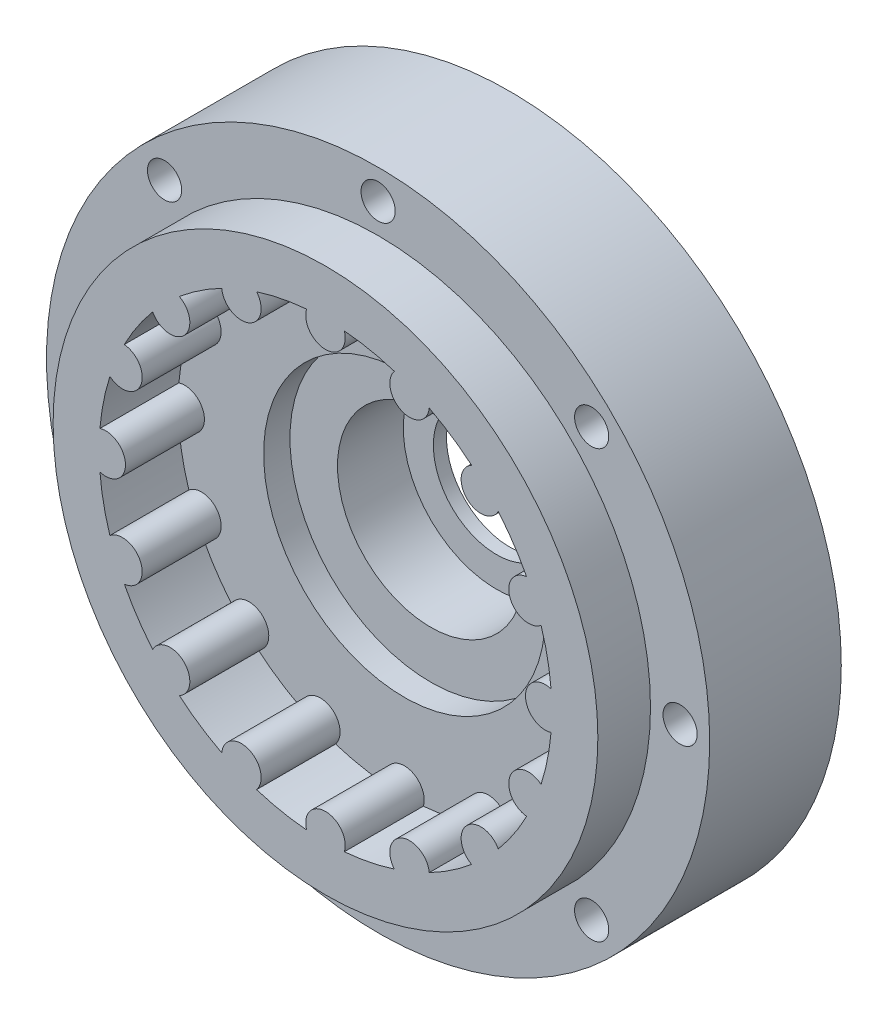
from build123d import *

# Parameters (mm, degrees)
SKETCH1_R             = 32.004
BOSS_EXTRUDE1_DEPTH   = 12.7
SKETCH2_OUTSIDE_W     = 84.29
SKETCH2_OUTSIDE_H     = 84.29
SKETCH2_OUTSIDE_R     = 32.004
SKETCH2_OUTSIDE_R_2   = 26.289
CUT_EXTRUDE1_DEPTH    = 2.54
SKETCH4_R             = 13.589
CUT_EXTRUDE3_DEPTH    = 2.54
SKETCH5_R             = 6.1
CUT_EXTRUDE4_DEPTH    = 46.897455616
M4X0_7_TAPPED_HOLE1_D = 3.3
SKETCH5_3_R           = 9
SKETCH5_3_R_2         = 6.1
CUT_EXTRUDE5_DEPTH    = 6.35
BOSS_EXTRUDE2_START   = 7.62
SKETCH8_R             = 26.289
SKETCH8_R_2           = 21.844
BOSS_EXTRUDE2_DEPTH   = 7.62
SKETCH3_R             = 1.905
BOSS_EXTRUDE3_DEPTH   = 7.62


with BuildPart() as part:
    # Sketch1 → Boss-Extrude1 (new body)
    with BuildSketch(Plane.XY):
        Circle(SKETCH1_R)
    extrude(amount=BOSS_EXTRUDE1_DEPTH)

    # Sketch2 outside → Cut-Extrude1 (cut)
    # profile 1 of 2: a face of its own
    with BuildSketch(Plane.XY.offset(12.7)):
        Rectangle(SKETCH2_OUTSIDE_W, SKETCH2_OUTSIDE_H)
        Circle(SKETCH2_OUTSIDE_R, mode=Mode.SUBTRACT)
    # profile 2 of 2: a face of its own
    with BuildSketch(Plane.XY.offset(12.7)):
        Circle(SKETCH2_OUTSIDE_R_2)
    extrude(amount=-CUT_EXTRUDE1_DEPTH, mode=Mode.SUBTRACT)

    # Sketch4 → Cut-Extrude3 (cut)
    with BuildSketch(Plane.XY.offset(10.16)):
        Circle(SKETCH4_R)
    extrude(amount=-CUT_EXTRUDE3_DEPTH, mode=Mode.SUBTRACT)

    # Sketch5 → Cut-Extrude4 (cut, through all)
    with BuildSketch(Plane.XY.offset(7.62)):
        Circle(SKETCH5_R)
    extrude(amount=-CUT_EXTRUDE4_DEPTH, mode=Mode.SUBTRACT)

    # M4x0.7 Tapped Hole1 (through all)
    with Locations(Plane.XY.offset(12.7)):
        with Locations((-20.609687798, 20.609687798), (0, 29.1465), (20.609687798, 20.609687798), (29.1465, 0), (20.609687798, -20.609687798), (0, -29.1465), (-20.609687798, -20.609687798), (-29.1465, 0)):
            Hole(M4X0_7_TAPPED_HOLE1_D / 2)

    # Sketch5<3> → Cut-Extrude5 (cut)
    with BuildSketch(Plane.XY.offset(7.62)):
        Circle(SKETCH5_3_R)
        Circle(SKETCH5_3_R_2, mode=Mode.SUBTRACT)
    extrude(amount=-CUT_EXTRUDE5_DEPTH, mode=Mode.SUBTRACT)

    # Sketch8 → Boss-Extrude2 (add)
    with BuildSketch(Plane.XY.offset(10.16).offset(BOSS_EXTRUDE2_START)):
        Circle(SKETCH8_R)
        Circle(SKETCH8_R_2, mode=Mode.SUBTRACT)
    extrude(amount=-BOSS_EXTRUDE2_DEPTH)

    # Sketch3 → Boss-Extrude3 (add)
    with BuildSketch(Plane.XY.offset(10.16)):
        with Locations((0, 21.209)):
            Circle(SKETCH3_R)
        with Locations((8.116332917, 19.594561005)):
            Circle(SKETCH3_R)
        with Locations((14.997027722, 14.997027722)):
            Circle(SKETCH3_R)
        with Locations((19.594561005, 8.116332917)):
            Circle(SKETCH3_R)
        with Locations((21.209, 0)):
            Circle(SKETCH3_R)
        with Locations((19.594561005, -8.116332917)):
            Circle(SKETCH3_R)
        with Locations((14.997027722, -14.997027722)):
            Circle(SKETCH3_R)
        with Locations((8.116332917, -19.594561005)):
            Circle(SKETCH3_R)
        with Locations((0, -21.209)):
            Circle(SKETCH3_R)
        with Locations((-8.116332917, -19.594561005)):
            Circle(SKETCH3_R)
        with Locations((-14.997027722, -14.997027722)):
            Circle(SKETCH3_R)
        with Locations((-19.594561005, -8.116332917)):
            Circle(SKETCH3_R)
        with Locations((-21.209, 0)):
            Circle(SKETCH3_R)
        with Locations((-19.594561005, 8.116332917)):
            Circle(SKETCH3_R)
        with Locations((-14.997027722, 14.997027722)):
            Circle(SKETCH3_R)
        with Locations((-8.116332917, 19.594561005)):
            Circle(SKETCH3_R)
    extrude(amount=BOSS_EXTRUDE3_DEPTH)


solid = part.part
